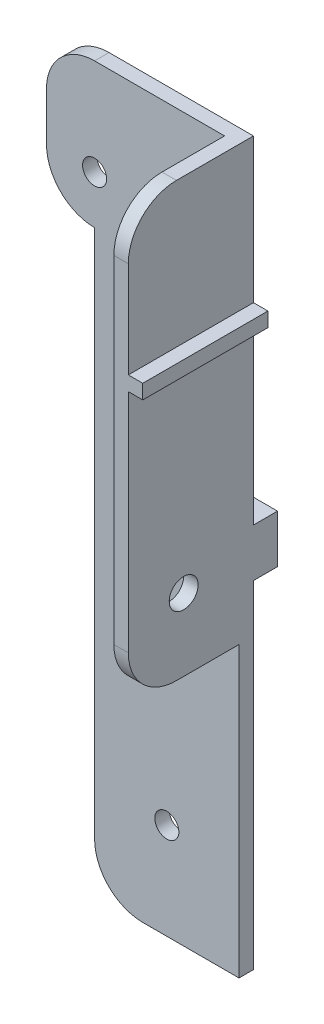
from build123d import *

# Parameters (mm, degrees)
SKETCH1_R             = 2.5
BOSS_EXTRUDE1_DEPTH   = 3
SKETCH1_W             = 30
SKETCH1_H             = 70
BOSS_EXTRUDE1_2_DEPTH = 3
SKETCH3_W             = 30
SKETCH3_H             = 10
BOSS_EXTRUDE2_DEPTH   = 8
SKETCH4_W             = 3
SKETCH4_H             = 150
BOSS_EXTRUDE4_DEPTH   = 23
SKETCH5_R             = 3
CUT_EXTRUDE1_DEPTH    = 23
SKETCH6_W             = 26
SKETCH6_H             = 3
BOSS_EXTRUDE5_DEPTH   = 3
FILLET1_R             = 10
SKETCH7_W             = 36.729037069
SKETCH7_H             = 60
CUT_EXTRUDE2_DEPTH    = 3
FILLET2_R             = 10


with BuildPart() as part:
    # Sketch1 → Boss-Extrude1 (new body)
    with BuildSketch(Plane.XY):
        Polygon((30, 150), (0, 150), (-10, 150), (-10, 120), (0, 120), (0, 80), (30, 80), (30, 120), align=None)
        with Locations((0, 130)):
            Circle(SKETCH1_R, mode=Mode.SUBTRACT)
    extrude(amount=-BOSS_EXTRUDE1_DEPTH)



with BuildPart() as body_2:
    # Sketch1 → Boss-Extrude1 2 (new body)
    with BuildSketch(Plane.XY):
        with Locations((15, 35)):
            Rectangle(SKETCH1_W, SKETCH1_H)
        with Locations((15, 20)):
            Circle(SKETCH1_R, mode=Mode.SUBTRACT)
    extrude(amount=-BOSS_EXTRUDE1_2_DEPTH)


with BuildPart() as part_1:
    add(part.part)

    add(body_2.part)  # Boss-Extrude2 merges body 2
    # Sketch3 → Boss-Extrude2 (add)
    with BuildSketch(Plane.XY):
        with Locations((15, 75)):
            Rectangle(SKETCH3_W, SKETCH3_H)
    extrude(amount=-BOSS_EXTRUDE2_DEPTH)

    # Sketch4 → Boss-Extrude4 (add)
    with BuildSketch(Plane.XY):
        with Locations((28.5, 75)):
            Rectangle(SKETCH4_W, SKETCH4_H)
    extrude(amount=BOSS_EXTRUDE4_DEPTH)

    # Sketch5 → Cut-Extrude1 (cut)
    with BuildSketch(Plane.ZY.offset(-27)):
        with Locations(Location((11.5, 75, 0), (0, 0, 270))):
            Circle(SKETCH5_R)
    extrude(amount=-CUT_EXTRUDE1_DEPTH, mode=Mode.SUBTRACT)

    # Sketch6 → Boss-Extrude5 (add)
    with BuildSketch(Plane(origin=(30, 0, 0), x_dir=(0, 0, -1), z_dir=(1, 0, 0))):
        with Locations((-10, 118.5)):
            Rectangle(SKETCH6_W, SKETCH6_H)
    extrude(amount=BOSS_EXTRUDE5_DEPTH)

    # Fillet1
    fillet1_edges = [part_1.edges().sort_by_distance(p)[0] for p in [
        (0, 0, -1.5),
        (28.5, 0, 23),
        (28.5, 150, 23),
        (-10, 120, -1.5),
        (-10, 150, -1.5),
    ]]
    fillet(fillet1_edges, radius=FILLET1_R - 0.0001)  # a hair under: the kernel refuses the full size

    # Sketch7 → Cut-Extrude2 (cut)
    with BuildSketch(Plane(origin=(30, 0, 0), x_dir=(0, 0, -1), z_dir=(1, 0, 0))):
        with Locations((-18.364518535, 30)):
            Rectangle(SKETCH7_W, SKETCH7_H)
    extrude(amount=-CUT_EXTRUDE2_DEPTH, mode=Mode.SUBTRACT)

    # Fillet2
    fillet2_edges = [part_1.edges().sort_by_distance(p)[0] for p in [
        (28.5, 60, 23),
    ]]
    fillet(fillet2_edges, radius=FILLET2_R)


solid = part_1.part
